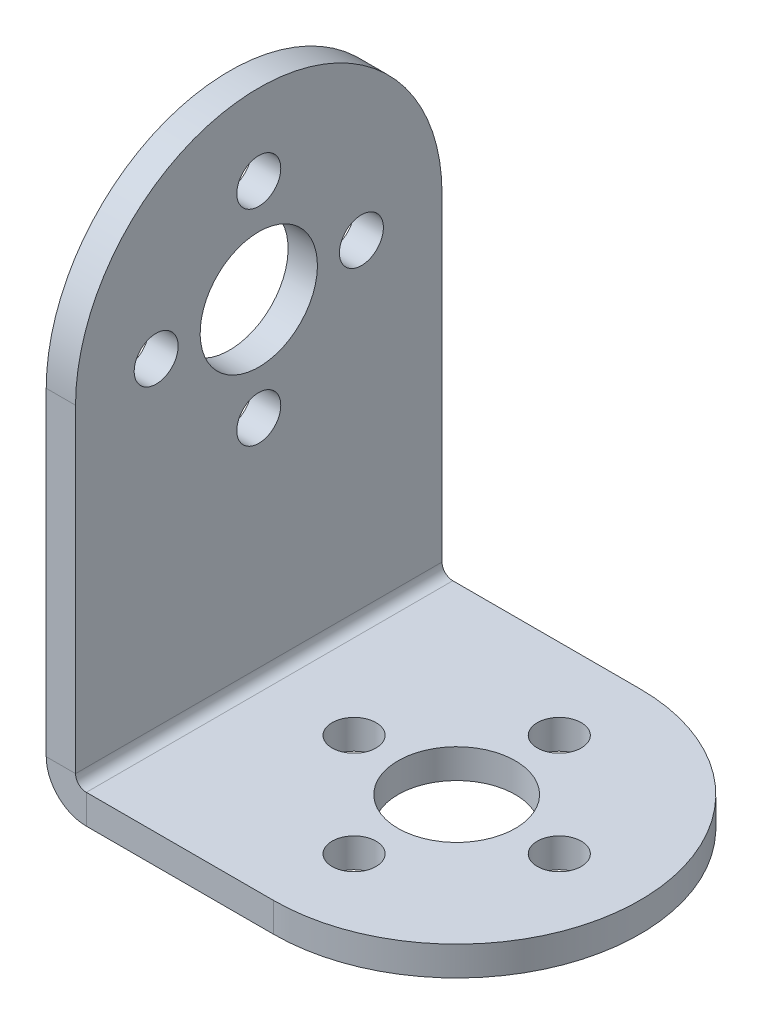
from build123d import *

# Parameters (mm, degrees)
SCHIZZO1_W                     = 28
SCHIZZO1_H                     = 25
BASE_FLANGIA1_DEPTH            = 2
BORDO_FLANGIA1_STRIP_W         = 9.4732
BORDO_FLANGIA1_STRIP_H         = 2
BORDO_FLANGIA1_STRIP_CUT_DEPTH = 25
BORDO_FLANGIA1_DEPTH           = 25
SCHIZZO3_R                     = 4
SCHIZZO3_R_2                   = 1.5
TAGLIO_ESTRUSIONE1_DEPTH       = 40.714606885
SCHIZZO4_R                     = 1.5
SCHIZZO4_R_2                   = 4
TAGLIO_ESTRUSIONE2_DEPTH       = 47.917480751


# Sheet-metal steps are written as plain solids
with BuildPart() as part:
    # Schizzo1 → Base-Flangia1 (new body)
    with BuildSketch(Plane(origin=(0, 0, 0), x_dir=(1, 0, 0), z_dir=(0, 1, 0))):
        Rectangle(SCHIZZO1_W, SCHIZZO1_H)
    extrude(amount=BASE_FLANGIA1_DEPTH)

    # Bordo-Flangia1 strip (across the edge) → Bordo-Flangia1 strip cut (cut)
    with BuildSketch(Plane(origin=(-14, 2, -12.5), x_dir=(1, 0, 0), z_dir=(0, 0, 1))):
        with Locations((-2, -1)):
            Rectangle(BORDO_FLANGIA1_STRIP_W, BORDO_FLANGIA1_STRIP_H)
    extrude(amount=BORDO_FLANGIA1_STRIP_CUT_DEPTH, mode=Mode.SUBTRACT)

    # Bordo-Flangia1 section (across the edge) → Bordo-Flangia1 (add)
    with BuildSketch(Plane(origin=(-14, 2, -12.5), x_dir=(1, 0, 0), z_dir=(0, 0, 1))):
        with BuildLine():
            Line((0, 0.7366), (0, 35))
            Line((0, 35), (2, 35))
            Line((2, 35), (2, 0.7366))
            ThreePointArc((2, 0.7366), (2.215745145, 0.215745145), (2.7366, 0))
            Line((2.7366, 0), (2.7366, -2))
            ThreePointArc((2.7366, -2), (0.801531583, -1.198468417), (0, 0.7366))
        make_face()
    extrude(amount=BORDO_FLANGIA1_DEPTH)

    # Schizzo3 → Taglio-Estrusione1 (cut, through all)
    with BuildSketch(Plane(origin=(0, 2, 0), x_dir=(1, 0, 0), z_dir=(0, 1, 0))):
        with Locations(Location((1.5, 0, 0), (0, 0, 270))):
            Circle(SCHIZZO3_R)
        with Locations(Location((1.5, 7, 0), (0, 0, 270))):
            Circle(SCHIZZO3_R_2)
        with Locations(Location((-5.5, 0, 0), (0, 0, 270))):
            Circle(SCHIZZO3_R_2)
        with Locations(Location((1.5, -7, 0), (0, 0, 270))):
            Circle(SCHIZZO3_R_2)
        with Locations(Location((8.5, 0, 0), (0, 0, 270))):
            Circle(SCHIZZO3_R_2)
        with BuildLine():
            ThreePointArc((1.5, 12.5), (10.338834766, 8.838834764), (14, -3e-09))
            Line((14, -3e-09), (14, 12.5))
            Line((14, 12.5), (1.5, 12.5))
        make_face()
        with BuildLine():
            ThreePointArc((14, -3e-09), (10.338834764, -8.838834766), (1.5, -12.5))
            Line((1.5, -12.5), (14, -12.5))
            Line((14, -12.5), (14, -3e-09))
        make_face()
    extrude(amount=-TAGLIO_ESTRUSIONE1_DEPTH, mode=Mode.SUBTRACT)

    # Schizzo4 → Taglio-Estrusione2 (cut, through all)
    with BuildSketch(Plane(origin=(-12, 0, 0), x_dir=(0, 0, -1), z_dir=(1, 0, 0))):
        with BuildLine():
            Line((12.5, 24.5), (12.5, 37))
            Line((12.5, 37), (3.9e-08, 37))
            ThreePointArc((3.9e-08, 37), (8.838834779, 33.338834751), (12.5, 24.5))
        make_face()
        with BuildLine():
            ThreePointArc((-12.5, 24.5), (-8.838834751, 33.338834779), (3.9e-08, 37))
            Line((3.9e-08, 37), (-12.5, 37))
            Line((-12.5, 37), (-12.5, 24.5))
        make_face()
        with Locations(Location((0, 31.5, 0), (0, 0, 90))):
            Circle(SCHIZZO4_R)
        with Locations(Location((0, 24.5, 0), (0, 0, 90))):
            Circle(SCHIZZO4_R_2)
        with Locations(Location((7, 24.5, 0), (0, 0, 90))):
            Circle(SCHIZZO4_R)
        with Locations(Location((0, 17.5, 0), (0, 0, 90))):
            Circle(SCHIZZO4_R)
        with Locations(Location((-7, 24.5, 0), (0, 0, 90))):
            Circle(SCHIZZO4_R)
    extrude(amount=-TAGLIO_ESTRUSIONE2_DEPTH, mode=Mode.SUBTRACT)


solid = part.part
